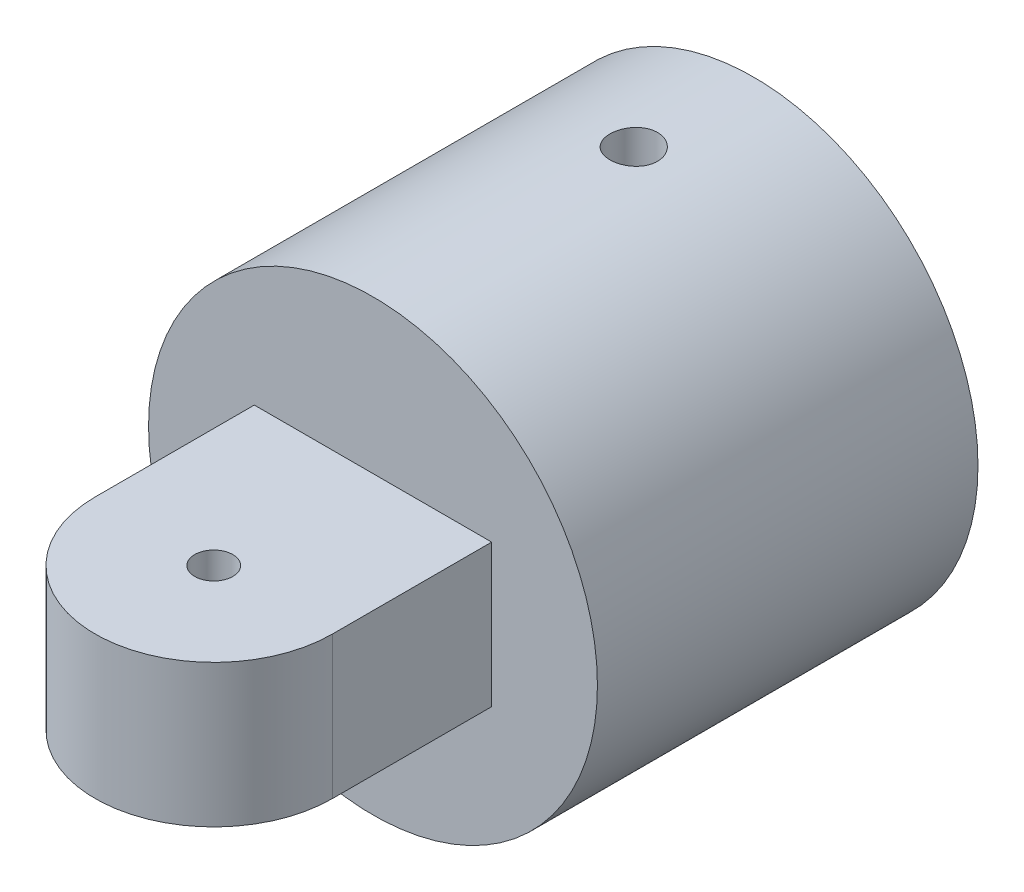
from build123d import *

# Parameters (mm, degrees)
RESSALTO_EXTRUS_O1_DEPTH      = 30
RESSALTO_EXTRUS_O1_DEPTH_BACK = 10
ESBO_O1_R                     = 23.59
RESSALTO_EXTRUS_O2_DEPTH      = 7.49
ESBO_O3_R                     = 2
CORTE_EXTRUS_O1_DEPTH         = 37.5
CUT_EXTRUDE1_DEPTH            = 68.960216691
CUT_EXTRUDE1_DEPTH_BACK       = 68.960216691
SKETCH1_R                     = 2.5


with BuildPart() as part:
    # Esboço1 → Ressalto-extrusão1 (new, two sides: drawn at the far end of the back side and taken through both)
    with BuildSketch(Plane.XY.offset(-RESSALTO_EXTRUS_O1_DEPTH_BACK)):
        Circle(ESBO_O1_R)
    extrude(amount=RESSALTO_EXTRUS_O1_DEPTH + RESSALTO_EXTRUS_O1_DEPTH_BACK)

    # Sketch1 → Cut-Extrude1 (cut, two sides: drawn at the far end of the back side and taken through both)
    with BuildSketch(Plane(origin=(0, 0, 0), x_dir=(1, 0, 0), z_dir=(0, 1, 0)).offset(-CUT_EXTRUDE1_DEPTH_BACK)):
        with Locations((0, -2.59265528)):
            Circle(SKETCH1_R)
    extrude(amount=CUT_EXTRUDE1_DEPTH + CUT_EXTRUDE1_DEPTH_BACK, mode=Mode.SUBTRACT)


with BuildPart() as body_2:
    # Esboço2 → Ressalto-extrusão2 (new, symmetric)
    with BuildSketch(Plane(origin=(0, 0, 0), x_dir=(1, 0, 0), z_dir=(0, 1, 0))):
        with BuildLine():
            Line((-12.473507345, -30), (12.473507345, -30))
            Line((12.473507345, -30), (12.473507345, -46.734725635))
            ThreePointArc((12.473507345, -46.734725635), (0, -59.20823298), (-12.473507345, -46.734725635))
            Line((-12.473507345, -46.734725635), (-12.473507345, -30))
        make_face()
    extrude(amount=RESSALTO_EXTRUS_O2_DEPTH, both=True)

    # Esboço3 → Corte-extrusão1 (cut, symmetric)
    with BuildSketch(Plane(origin=(0, 7.49, 0), x_dir=(1, 0, 0), z_dir=(0, 1, 0))):
        with Locations((0, -46.734725635)):
            Circle(ESBO_O3_R)
    extrude(amount=CORTE_EXTRUS_O1_DEPTH, both=True, mode=Mode.SUBTRACT)


solid = Compound([part.part, body_2.part])
